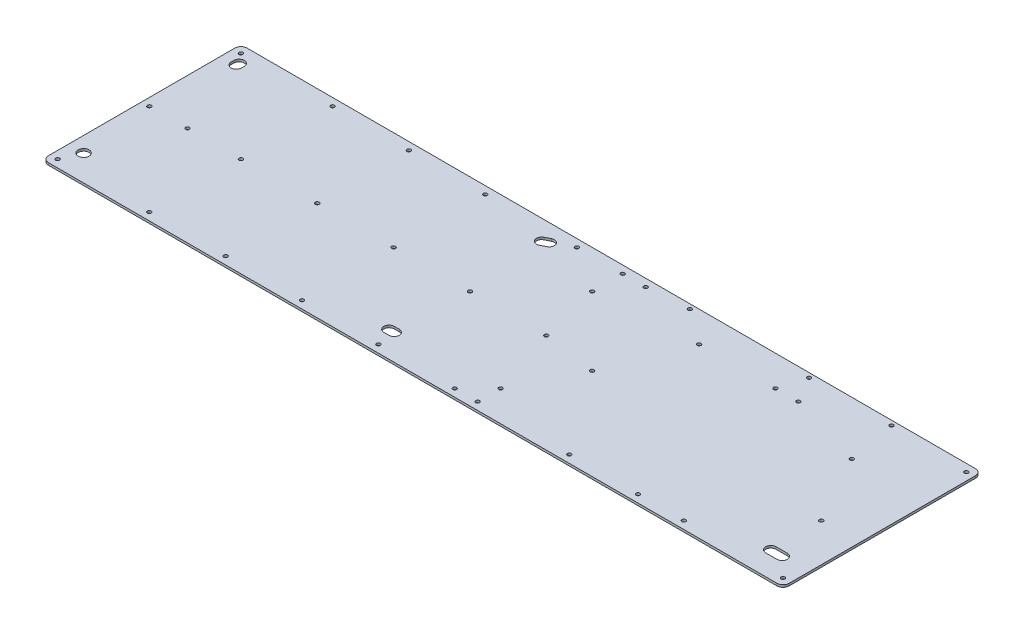
from build123d import *

# Parameters (mm, degrees)
BOSS_EXTRUDE1_START = -4
SKETCH1_W           = 485
SKETCH1_H           = 130
SKETCH1_R           = 1.25
SKETCH1_R_2         = 3.577154457
BOSS_EXTRUDE1_DEPTH = 1.5
FILLET1_R           = 4


with BuildPart() as part:
    # Sketch1 → Boss-Extrude1 (new body)
    with BuildSketch(Plane(origin=(0, 0, 0), x_dir=(1, 0, 0), z_dir=(0, 1, 0)).offset(BOSS_EXTRUDE1_START)):
        with Locations((242.5, 65)):
            Rectangle(SKETCH1_W, SKETCH1_H)
        with Locations((5, 5)):
            Circle(SKETCH1_R, mode=Mode.SUBTRACT)
        with Locations((65, 5)):
            Circle(SKETCH1_R, mode=Mode.SUBTRACT)
        with Locations((115, 5)):
            Circle(SKETCH1_R, mode=Mode.SUBTRACT)
        with Locations((10, 17)):
            Circle(SKETCH1_R_2, mode=Mode.SUBTRACT)
        with Locations((165, 5)):
            Circle(SKETCH1_R, mode=Mode.SUBTRACT)
        with Locations((215, 5)):
            Circle(SKETCH1_R, mode=Mode.SUBTRACT)
        with BuildLine():
            ThreePointArc((209.988861787, 13.591030759), (206.579892546, 17), (209.988861787, 20.408969241))
            Line((209.988861787, 20.408969241), (213.303344556, 20.408969241))
            ThreePointArc((213.303344556, 20.408969241), (216.712313797, 17), (213.303344556, 13.591030759))
            Line((213.303344556, 13.591030759), (209.988861787, 13.591030759))
        make_face(mode=Mode.SUBTRACT)
        with Locations((265, 5)):
            Circle(SKETCH1_R, mode=Mode.SUBTRACT)
        with Locations((280, 5)):
            Circle(SKETCH1_R, mode=Mode.SUBTRACT)
        with Locations((339.996937627, 5)):
            Circle(SKETCH1_R, mode=Mode.SUBTRACT)
        with Locations((280, 20)):
            Circle(SKETCH1_R, mode=Mode.SUBTRACT)
        with Locations((385, 5)):
            Circle(SKETCH1_R, mode=Mode.SUBTRACT)
        with Locations((415, 5)):
            Circle(SKETCH1_R, mode=Mode.SUBTRACT)
        with Locations((480, 5)):
            Circle(SKETCH1_R, mode=Mode.SUBTRACT)
        with BuildLine():
            ThreePointArc((467.376612972, 20.44133949), (470.817952462, 17), (467.376612972, 13.55866051))
            Line((467.376612972, 13.55866051), (460, 13.55866051))
            ThreePointArc((460, 13.55866051), (456.55866051, 17), (460, 20.44133949))
            Line((460, 20.44133949), (467.376612972, 20.44133949))
        make_face(mode=Mode.SUBTRACT)
        with Locations((300, 60)):
            Circle(SKETCH1_R, mode=Mode.SUBTRACT)
        with Locations((460, 50)):
            Circle(SKETCH1_R, mode=Mode.SUBTRACT)
        with Locations((5, 65)):
            Circle(SKETCH1_R, mode=Mode.SUBTRACT)
        with Locations((30, 65)):
            Circle(SKETCH1_R, mode=Mode.SUBTRACT)
        with Locations((65, 65)):
            Circle(SKETCH1_R, mode=Mode.SUBTRACT)
        with Locations((115, 65)):
            Circle(SKETCH1_R, mode=Mode.SUBTRACT)
        with Locations((165, 65)):
            Circle(SKETCH1_R, mode=Mode.SUBTRACT)
        with Locations((215, 65)):
            Circle(SKETCH1_R, mode=Mode.SUBTRACT)
        with BuildLine():
            ThreePointArc((6.670366044, 118.712635694), (10.078491462, 122.120761111), (13.486616879, 118.712635694))
            Line((13.486616879, 118.712635694), (13.486616879, 116.888420957))
            ThreePointArc((13.486616879, 116.888420957), (10.078491462, 113.48029554), (6.670366044, 116.888420957))
            Line((6.670366044, 116.888420957), (6.670366044, 118.712635694))
        make_face(mode=Mode.SUBTRACT)
        with Locations((5, 125)):
            Circle(SKETCH1_R, mode=Mode.SUBTRACT)
        with Locations((65, 125)):
            Circle(SKETCH1_R, mode=Mode.SUBTRACT)
        with Locations((115, 125)):
            Circle(SKETCH1_R, mode=Mode.SUBTRACT)
        with Locations((165, 125)):
            Circle(SKETCH1_R, mode=Mode.SUBTRACT)
        with BuildLine():
            ThreePointArc((211.795260954, 121.617813484), (216.3210423, 120.108199341), (214.811428157, 115.582417996))
            Line((214.811428157, 115.582417996), (211.496945388, 113.926017145))
            ThreePointArc((211.496945388, 113.926017145), (206.971164043, 115.435631287), (208.480778185, 119.961412632))
            Line((208.480778185, 119.961412632), (211.795260954, 121.617813484))
        make_face(mode=Mode.SUBTRACT)
        with Locations((225, 125)):
            Circle(SKETCH1_R, mode=Mode.SUBTRACT)
        with Locations((265, 65)):
            Circle(SKETCH1_R, mode=Mode.SUBTRACT)
        with Locations((435, 95)):
            Circle(SKETCH1_R, mode=Mode.SUBTRACT)
        with Locations((255, 105)):
            Circle(SKETCH1_R, mode=Mode.SUBTRACT)
        with Locations((320, 110)):
            Circle(SKETCH1_R, mode=Mode.SUBTRACT)
        with Locations((255, 125)):
            Circle(SKETCH1_R, mode=Mode.SUBTRACT)
        with Locations((270, 125)):
            Circle(SKETCH1_R, mode=Mode.SUBTRACT)
        with Locations((297, 127)):
            Circle(SKETCH1_R, mode=Mode.SUBTRACT)
        with Locations((369.997825764, 110.029448802)):
            Circle(SKETCH1_R, mode=Mode.SUBTRACT)
        with Locations((385, 110.029448802)):
            Circle(SKETCH1_R, mode=Mode.SUBTRACT)
        with Locations((374.95, 127)):
            Circle(SKETCH1_R, mode=Mode.SUBTRACT)
        with Locations((429, 127)):
            Circle(SKETCH1_R, mode=Mode.SUBTRACT)
        with Locations((480, 125)):
            Circle(SKETCH1_R, mode=Mode.SUBTRACT)
    extrude(amount=-BOSS_EXTRUDE1_DEPTH)

    # Fillet1
    fillet1_edges = [part.edges().sort_by_distance(p)[0] for p in [
        (485, -4.75, 0),
        (485, -4.75, -130),
        (0, -4.75, 0),
        (0, -4.75, -130),
    ]]
    fillet(fillet1_edges, radius=FILLET1_R)


solid = part.part
